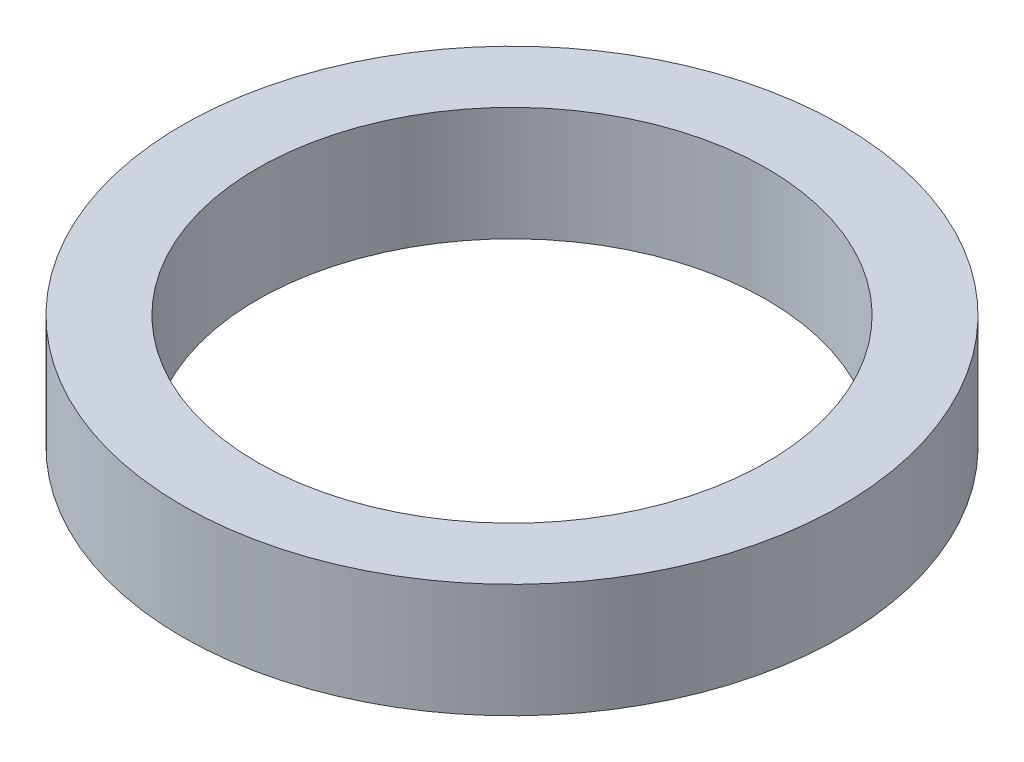
from build123d import *

# Parameters (mm, degrees)
SKETCH1_R           = 55
BOSS_EXTRUDE1_DEPTH = 19
SKETCH2_R           = 42.5
CUT_EXTRUDE1_DEPTH  = 81.068720484


with BuildPart() as part:
    # Sketch1 → Boss-Extrude1 (new body)
    with BuildSketch(Plane(origin=(0, 0, 0), x_dir=(1, 0, 0), z_dir=(0, 1, 0))):
        Circle(SKETCH1_R)
    extrude(amount=BOSS_EXTRUDE1_DEPTH)

    # Sketch2 → Cut-Extrude1 (cut, through all)
    with BuildSketch(Plane(origin=(0, 0, 0), x_dir=(1, 0, 0), z_dir=(0, 1, 0))):
        Circle(SKETCH2_R)
    extrude(amount=CUT_EXTRUDE1_DEPTH, mode=Mode.SUBTRACT)


solid = part.part
